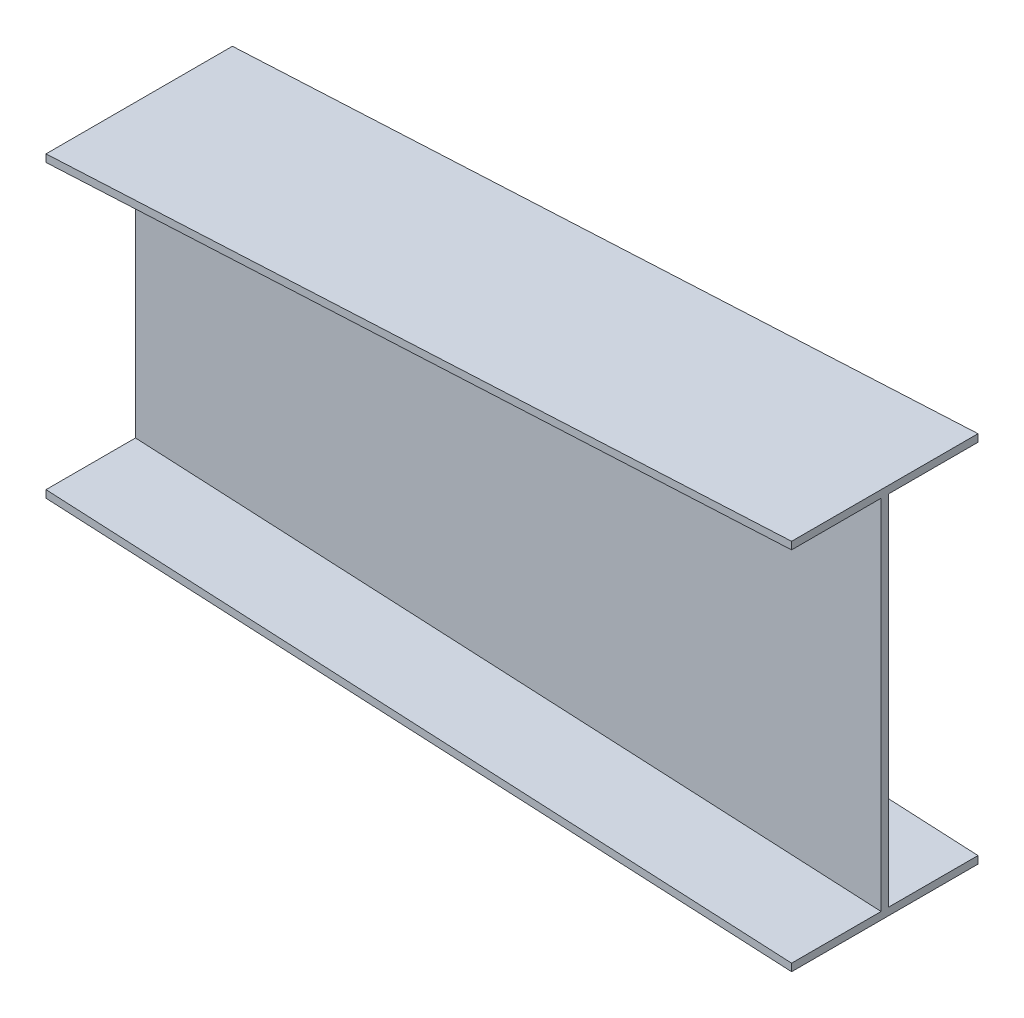
from build123d import *


with BuildPart() as part:
    # Sketch1 → Loft4 section 0
    with BuildSketch(Plane(origin=(0, 0, 0), x_dir=(0, 0, -1), z_dir=(1, 0, 0))):
        with BuildLine():
            Line((-130, 200), (120, 200))
            Line((120, 200), (120, 190))
            Line((120, 190), (0, 190))
            Line((0, 190), (0, -190))
            Line((0, -190), (120, -190))
            Line((120, -190), (120, -200))
            Line((120, -200), (-130, -200))
            Line((-130, -200), (-130, -190))
            Line((-130, -190), (-10, -190))
            Line((-10, -190), (-10, 190))
            Line((-10, 190), (-130, 190))
            Line((-130, 190), (-130, 200))
        make_face()
    # Sketch4 → Loft4 section 1
    with BuildSketch(Plane(origin=(1000, 0, -1000), x_dir=(0, 0, 1), z_dir=(-1, 0, 0))):
        with BuildLine():
            Line((880, 250), (1130, 250))
            Line((1130, 250), (1130, 240))
            Line((1130, 240), (1010, 240))
            Line((1010, 240), (1010, -240))
            Line((1010, -240), (1130, -240))
            Line((1130, -240), (1130, -250))
            Line((1130, -250), (880, -250))
            Line((880, -250), (880, -240))
            Line((880, -240), (1000, -240))
            Line((1000, -240), (1000, 240))
            Line((1000, 240), (880, 240))
            Line((880, 240), (880, 250))
        make_face()
    loft()


solid = part.part
